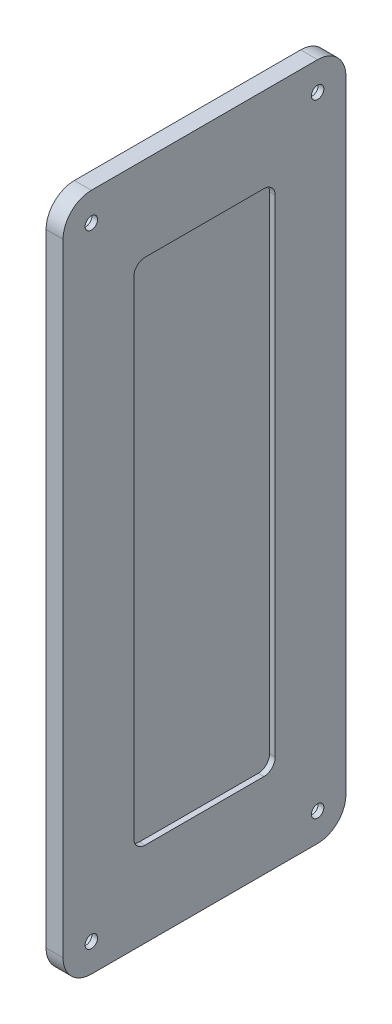
from build123d import *

# Parameters (mm, degrees)
SKETCH1_W           = 50
SKETCH1_H           = 120
SKETCH1_W_2         = 25
SKETCH1_H_2         = 90
BOSS_EXTRUDE1_DEPTH = 3
SKETCH1_3_W         = 25
SKETCH1_3_H         = 90
BOSS_EXTRUDE2_DEPTH = 2
SKETCH2_R           = 2
CUT_EXTRUDE1_DEPTH  = 2
SKETCH3_R           = 1.1
CUT_EXTRUDE2_DEPTH  = 3
FILLET1_R           = 5
FILLET2_R           = 2


with BuildPart() as part:
    # Sketch1 → Boss-Extrude1 (new body)
    with BuildSketch(Plane(origin=(0, 0, 0), x_dir=(0, 0, -1), z_dir=(1, 0, 0))):
        Rectangle(SKETCH1_W, SKETCH1_H)
        Rectangle(SKETCH1_W_2, SKETCH1_H_2, mode=Mode.SUBTRACT)
    extrude(amount=BOSS_EXTRUDE1_DEPTH)

    # Sketch1<3> → Boss-Extrude2 (add)
    with BuildSketch(Plane(origin=(0, 0, 0), x_dir=(0, 0, -1), z_dir=(1, 0, 0))):
        Rectangle(SKETCH1_3_W, SKETCH1_3_H)
    extrude(amount=BOSS_EXTRUDE2_DEPTH)

    # Sketch2 → Cut-Extrude1 (cut)
    with BuildSketch(Plane.ZY):
        with Locations((-20, 55)):
            Circle(SKETCH2_R)
        with Locations((20, 55)):
            Circle(SKETCH2_R)
        with Locations((-20, -55)):
            Circle(SKETCH2_R)
        with Locations((20, -55)):
            Circle(SKETCH2_R)
    extrude(amount=-CUT_EXTRUDE1_DEPTH, mode=Mode.SUBTRACT)

    # Sketch3 → Cut-Extrude2 (cut)
    with BuildSketch(Plane.ZY):
        with Locations((-20, 55)):
            Circle(SKETCH3_R)
        with Locations((20, 55)):
            Circle(SKETCH3_R)
        with Locations((-20, -55)):
            Circle(SKETCH3_R)
        with Locations((20, -55)):
            Circle(SKETCH3_R)
    extrude(amount=-CUT_EXTRUDE2_DEPTH, mode=Mode.SUBTRACT)

    # Fillet1
    fillet1_edges = [part.edges().sort_by_distance(p)[0] for p in [
        (1.5, -60, 25),
        (1.5, -60, -25),
        (1.5, 60, -25),
        (1.5, 60, 25),
    ]]
    fillet(fillet1_edges, radius=FILLET1_R)

    # Fillet2
    fillet2_edges = [part.edges().sort_by_distance(p)[0] for p in [
        (2.5, 45, 12.5),
        (2.5, -45, 12.5),
        (2.5, -45, -12.5),
        (2.5, 45, -12.5),
    ]]
    fillet(fillet2_edges, radius=FILLET2_R)


solid = part.part
